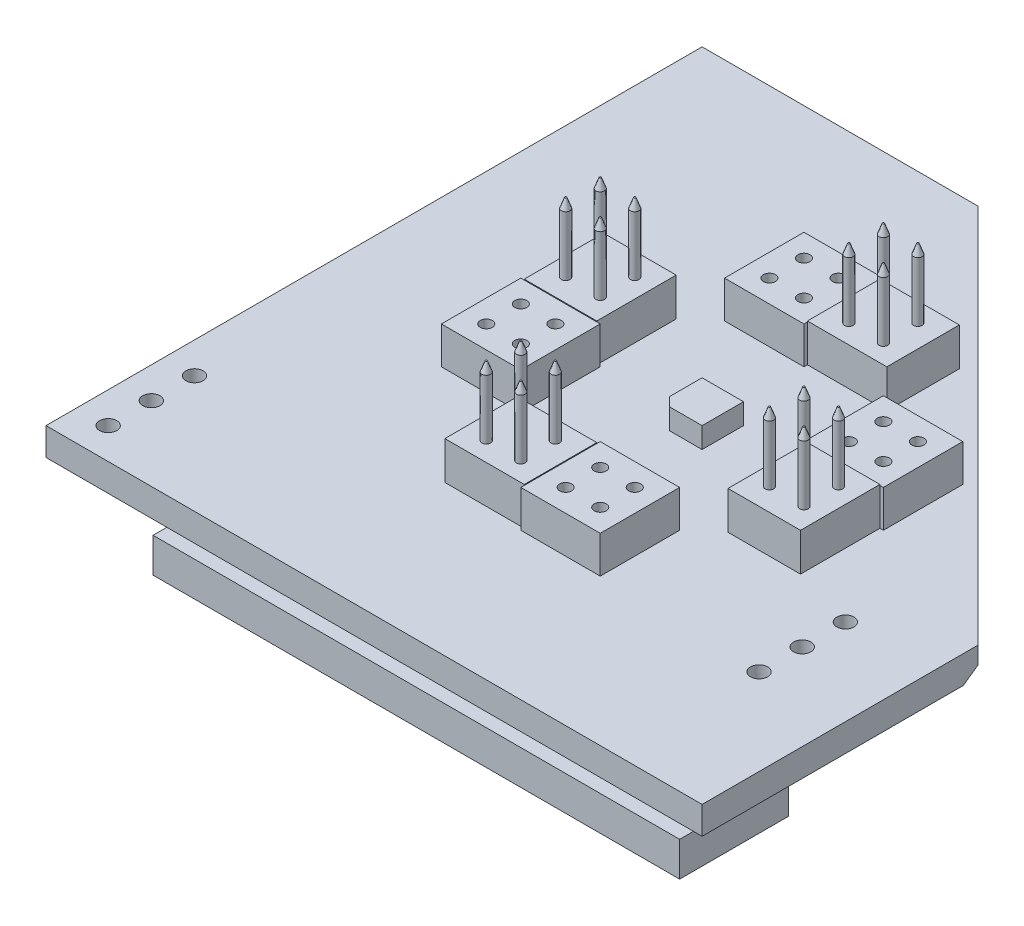
from build123d import *
from OCP.BRepFilletAPI import BRepFilletAPI_MakeChamfer
from build123d.topology import SkipClean

# Parameters (mm, degrees)
EXTRUDE1_DEPTH       = 1.6
SKETCH2_W            = 4.6
SKETCH2_H            = 4.6
EXTRUDE2_DEPTH       = 2.15
SKETCH3_W            = 4.6
SKETCH3_H            = 4.2
SKETCH3_W_2          = 4.2
SKETCH3_H_2          = 4.6
EXTRUDE3_DEPTH       = 2.2
SKETCH4_R            = 0.35
CUT_EXTRUDE1_DEPTH   = 2.15
SKETCH5_R            = 0.25
EXTRUDE4_DEPTH       = 4
CHAMFER1_SIZE        = 0.2
CHAMFER1_SIZE2       = 0.549495484
SKETCH6_W            = 30.5
SKETCH6_H            = 6.3
EXTRUDE5_DEPTH       = 2
CHAMFER2_SIZE        = 0.6
EXTRUDE7_DEPTH       = 1.2
SKETCH14_R           = 0.5
CUT_EXTRUDE2_DEPTH   = 29.528582159
EXTRUDE13_DEPTH      = 0.05
EXTRUDE13_DEPTH_BACK = 1.05
SKETCH15_R           = 0.95
SKETCH15_R_2         = 0.5
SKETCH21_W           = 3.25
SKETCH21_H           = 3.25
EXTRUDE19_DEPTH      = 1.1
SKETCH22_W           = 0.8
SKETCH22_H           = 1.6
SKETCH22_W_2         = 2
SKETCH22_H_2         = 1.3
SKETCH22_W_3         = 1.6
SKETCH22_H_3         = 0.8
EXTRUDE20_DEPTH      = 0.5
EXTRUDE21_DEPTH      = 5
SKETCH24_W           = 7.3
SKETCH24_H           = 4.25
EXTRUDE22_DEPTH      = 2.8
SKETCH25_W           = 4.7
SKETCH25_H           = 6
EXTRUDE23_DEPTH      = 1.5
SKETCH26_W           = 2.2
SKETCH26_H           = 4.2
EXTRUDE24_DEPTH      = 2.3


with BuildPart() as part:
    # Sketch1 → Extrude1 (new body)
    with BuildSketch(Plane(origin=(0, 0, 0), x_dir=(1, 0, 0), z_dir=(0, 1, 0))):
        Polygon((19, -3.019386745), (-3.019386745, 19), (-19, 19), (-19, -19), (19, -19), align=None)
    extrude(amount=EXTRUDE1_DEPTH)

    # Sketch2 → Extrude2 (add)
    with BuildSketch(Plane(origin=(0, 1.6, 0), x_dir=(-1, 0, 0), z_dir=(0, 1, 0))):
        with Locations((-8.2, -2.3)):
            Rectangle(SKETCH2_W, SKETCH2_H)
        with Locations((2.3, -8.2)):
            Rectangle(SKETCH2_W, SKETCH2_H)
        with Locations((-2.3, 8.2)):
            Rectangle(SKETCH2_W, SKETCH2_H)
        with Locations((8.2, 2.3)):
            Rectangle(SKETCH2_W, SKETCH2_H)
    extrude(amount=EXTRUDE2_DEPTH)

    # Sketch3 → Extrude3 (add)
    with BuildSketch(Plane(origin=(0, 1.6, 0), x_dir=(-1, 0, 0), z_dir=(0, 1, 0))):
        with Locations((-2.3, -8.2)):
            Rectangle(SKETCH3_W, SKETCH3_H)
        with Locations((-8.2, 2.3)):
            Rectangle(SKETCH3_W_2, SKETCH3_H_2)
        with Locations((2.3, 8.2)):
            Rectangle(SKETCH3_W, SKETCH3_H)
        with Locations((8.2, -2.3)):
            Rectangle(SKETCH3_W_2, SKETCH3_H_2)
    extrude(amount=EXTRUDE3_DEPTH)

    # Sketch4 → Cut-Extrude1 (cut)
    with BuildSketch(Plane(origin=(0, 3.75, 0), x_dir=(-1, 0, 0), z_dir=(0, 1, 0))):
        with Locations(Location((3.3, -9.2, 0), (0, 0, 90))):
            Circle(SKETCH4_R)
        with Locations(Location((1.3, -9.2, 0), (0, 0, 90))):
            Circle(SKETCH4_R)
        with Locations(Location((1.3, -7.2, 0), (0, 0, 90))):
            Circle(SKETCH4_R)
        with Locations(Location((3.3, -7.2, 0), (0, 0, 90))):
            Circle(SKETCH4_R)
        with Locations(Location((-9.2, -3.3, 0), (0, 0, 90))):
            Circle(SKETCH4_R)
        with Locations(Location((-9.2, -1.3, 0), (0, 0, 90))):
            Circle(SKETCH4_R)
        with Locations(Location((-7.2, -1.3, 0), (0, 0, 90))):
            Circle(SKETCH4_R)
        with Locations(Location((-7.2, -3.3, 0), (0, 0, 90))):
            Circle(SKETCH4_R)
        with Locations(Location((-3.3, 9.2, 0), (0, 0, 90))):
            Circle(SKETCH4_R)
        with Locations(Location((-1.3, 9.2, 0), (0, 0, 90))):
            Circle(SKETCH4_R)
        with Locations(Location((-1.3, 7.2, 0), (0, 0, 90))):
            Circle(SKETCH4_R)
        with Locations(Location((-3.3, 7.2, 0), (0, 0, 90))):
            Circle(SKETCH4_R)
        with Locations(Location((9.2, 3.3, 0), (0, 0, 90))):
            Circle(SKETCH4_R)
        with Locations(Location((9.2, 1.3, 0), (0, 0, 90))):
            Circle(SKETCH4_R)
        with Locations(Location((7.2, 1.3, 0), (0, 0, 90))):
            Circle(SKETCH4_R)
        with Locations(Location((7.2, 3.3, 0), (0, 0, 90))):
            Circle(SKETCH4_R)
    extrude(amount=-CUT_EXTRUDE1_DEPTH, mode=Mode.SUBTRACT)

    # Sketch5 → Extrude4 (add)
    with BuildSketch(Plane(origin=(0, 3.8, 0), x_dir=(-1, 0, 0), z_dir=(0, 1, 0))):
        with Locations(Location((-1.3, -9.2, 0), (0, 0, 270))):
            Circle(SKETCH5_R)
        with Locations(Location((-3.3, -9.2, 0), (0, 0, 270))):
            Circle(SKETCH5_R)
        with Locations(Location((-3.3, -7.2, 0), (0, 0, 270))):
            Circle(SKETCH5_R)
        with Locations(Location((-1.3, -7.2, 0), (0, 0, 270))):
            Circle(SKETCH5_R)
        with Locations(Location((-7.2, 1.3, 0), (0, 0, 270))):
            Circle(SKETCH5_R)
        with Locations(Location((-9.2, 1.3, 0), (0, 0, 90))):
            Circle(SKETCH5_R)
        with Locations(Location((-9.2, 3.3, 0), (0, 0, 270))):
            Circle(SKETCH5_R)
        with Locations(Location((-7.2, 3.3, 0), (0, 0, 90))):
            Circle(SKETCH5_R)
        with Locations(Location((1.3, 7.2, 0), (0, 0, 270))):
            Circle(SKETCH5_R)
        with Locations(Location((1.3, 9.2, 0), (0, 0, 90))):
            Circle(SKETCH5_R)
        with Locations(Location((3.3, 9.2, 0), (0, 0, 270))):
            Circle(SKETCH5_R)
        with Locations(Location((3.3, 7.2, 0), (0, 0, 90))):
            Circle(SKETCH5_R)
        with Locations(Location((7.2, -1.3, 0), (0, 0, 270))):
            Circle(SKETCH5_R)
        with Locations(Location((9.2, -1.3, 0), (0, 0, 90))):
            Circle(SKETCH5_R)
        with Locations(Location((9.2, -3.3, 0), (0, 0, 270))):
            Circle(SKETCH5_R)
        with Locations(Location((7.2, -3.3, 0), (0, 0, 90))):
            Circle(SKETCH5_R)
    extrude(amount=EXTRUDE4_DEPTH)

    # Chamfer1: one chamfer whose edges measure the first distance from different faces: ONE call of the kernel's chamfer builder (chamfer() names one face for all edges)
    chamfer1_edges_1 = [part.edges().sort_by_distance(p)[0] for p in [
        (1.3, 7.8, -8.95),
    ]]
    chamfer1_side_1 = [part.faces().sort_by_distance(p)[0] for p in [
        (1.3, 7.8, -9.2),
    ]]
    chamfer1_edges_2 = [part.edges().sort_by_distance(p)[0] for p in [
        (3.3, 7.8, -8.95),
    ]]
    chamfer1_side_2 = [part.faces().sort_by_distance(p)[0] for p in [
        (3.3, 7.8, -9.2),
    ]]
    chamfer1_edges_3 = [part.edges().sort_by_distance(p)[0] for p in [
        (3.3, 7.8, -6.95),
    ]]
    chamfer1_side_3 = [part.faces().sort_by_distance(p)[0] for p in [
        (3.3, 7.8, -7.2),
    ]]
    chamfer1_edges_4 = [part.edges().sort_by_distance(p)[0] for p in [
        (1.3, 7.8, -6.95),
    ]]
    chamfer1_side_4 = [part.faces().sort_by_distance(p)[0] for p in [
        (1.3, 7.8, -7.2),
    ]]
    chamfer1_edges_5 = [part.edges().sort_by_distance(p)[0] for p in [
        (9.2, 7.8, 1.05),
    ]]
    chamfer1_side_5 = [part.faces().sort_by_distance(p)[0] for p in [
        (9.2, 7.8, 1.3),
    ]]
    chamfer1_edges_6 = [part.edges().sort_by_distance(p)[0] for p in [
        (9.2, 7.8, 3.55),
    ]]
    chamfer1_side_6 = [part.faces().sort_by_distance(p)[0] for p in [
        (9.2, 7.8, 3.3),
    ]]
    chamfer1_edges_7 = [part.edges().sort_by_distance(p)[0] for p in [
        (7.2, 7.8, 3.05),
    ]]
    chamfer1_side_7 = [part.faces().sort_by_distance(p)[0] for p in [
        (7.2, 7.8, 3.3),
    ]]
    chamfer1_edges_8 = [part.edges().sort_by_distance(p)[0] for p in [
        (7.2, 7.8, 1.55),
    ]]
    chamfer1_side_8 = [part.faces().sort_by_distance(p)[0] for p in [
        (7.2, 7.8, 1.3),
    ]]
    chamfer1_edges_9 = [part.edges().sort_by_distance(p)[0] for p in [
        (-1.3, 7.8, 8.95),
    ]]
    chamfer1_side_9 = [part.faces().sort_by_distance(p)[0] for p in [
        (-1.3, 7.8, 9.2),
    ]]
    chamfer1_edges_10 = [part.edges().sort_by_distance(p)[0] for p in [
        (-3.3, 7.8, 9.45),
    ]]
    chamfer1_side_10 = [part.faces().sort_by_distance(p)[0] for p in [
        (-3.3, 7.8, 9.2),
    ]]
    chamfer1_edges_11 = [part.edges().sort_by_distance(p)[0] for p in [
        (-3.3, 7.8, 6.95),
    ]]
    chamfer1_side_11 = [part.faces().sort_by_distance(p)[0] for p in [
        (-3.3, 7.8, 7.2),
    ]]
    chamfer1_edges_12 = [part.edges().sort_by_distance(p)[0] for p in [
        (-1.3, 7.8, 7.45),
    ]]
    chamfer1_side_12 = [part.faces().sort_by_distance(p)[0] for p in [
        (-1.3, 7.8, 7.2),
    ]]
    chamfer1_edges_13 = [part.edges().sort_by_distance(p)[0] for p in [
        (-9.2, 7.8, -1.55),
    ]]
    chamfer1_side_13 = [part.faces().sort_by_distance(p)[0] for p in [
        (-9.2, 7.8, -1.3),
    ]]
    chamfer1_edges_14 = [part.edges().sort_by_distance(p)[0] for p in [
        (-9.2, 7.8, -3.05),
    ]]
    chamfer1_side_14 = [part.faces().sort_by_distance(p)[0] for p in [
        (-9.2, 7.8, -3.3),
    ]]
    chamfer1_edges_15 = [part.edges().sort_by_distance(p)[0] for p in [
        (-7.2, 7.8, -3.55),
    ]]
    chamfer1_side_15 = [part.faces().sort_by_distance(p)[0] for p in [
        (-7.2, 7.8, -3.3),
    ]]
    chamfer1_edges_16 = [part.edges().sort_by_distance(p)[0] for p in [
        (-7.2, 7.8, -1.05),
    ]]
    chamfer1_side_16 = [part.faces().sort_by_distance(p)[0] for p in [
        (-7.2, 7.8, -1.3),
    ]]
    chamfer1 = BRepFilletAPI_MakeChamfer(part.part.solid().wrapped)
    for e in chamfer1_edges_1:
        chamfer1.Add(CHAMFER1_SIZE, CHAMFER1_SIZE2, e.wrapped, chamfer1_side_1[0].wrapped)  # the first distance lies on this face
    for e in chamfer1_edges_2:
        chamfer1.Add(CHAMFER1_SIZE, CHAMFER1_SIZE2, e.wrapped, chamfer1_side_2[0].wrapped)  # the first distance lies on this face
    for e in chamfer1_edges_3:
        chamfer1.Add(CHAMFER1_SIZE, CHAMFER1_SIZE2, e.wrapped, chamfer1_side_3[0].wrapped)  # the first distance lies on this face
    for e in chamfer1_edges_4:
        chamfer1.Add(CHAMFER1_SIZE, CHAMFER1_SIZE2, e.wrapped, chamfer1_side_4[0].wrapped)  # the first distance lies on this face
    for e in chamfer1_edges_5:
        chamfer1.Add(CHAMFER1_SIZE, CHAMFER1_SIZE2, e.wrapped, chamfer1_side_5[0].wrapped)  # the first distance lies on this face
    for e in chamfer1_edges_6:
        chamfer1.Add(CHAMFER1_SIZE, CHAMFER1_SIZE2, e.wrapped, chamfer1_side_6[0].wrapped)  # the first distance lies on this face
    for e in chamfer1_edges_7:
        chamfer1.Add(CHAMFER1_SIZE, CHAMFER1_SIZE2, e.wrapped, chamfer1_side_7[0].wrapped)  # the first distance lies on this face
    for e in chamfer1_edges_8:
        chamfer1.Add(CHAMFER1_SIZE, CHAMFER1_SIZE2, e.wrapped, chamfer1_side_8[0].wrapped)  # the first distance lies on this face
    for e in chamfer1_edges_9:
        chamfer1.Add(CHAMFER1_SIZE, CHAMFER1_SIZE2, e.wrapped, chamfer1_side_9[0].wrapped)  # the first distance lies on this face
    for e in chamfer1_edges_10:
        chamfer1.Add(CHAMFER1_SIZE, CHAMFER1_SIZE2, e.wrapped, chamfer1_side_10[0].wrapped)  # the first distance lies on this face
    for e in chamfer1_edges_11:
        chamfer1.Add(CHAMFER1_SIZE, CHAMFER1_SIZE2, e.wrapped, chamfer1_side_11[0].wrapped)  # the first distance lies on this face
    for e in chamfer1_edges_12:
        chamfer1.Add(CHAMFER1_SIZE, CHAMFER1_SIZE2, e.wrapped, chamfer1_side_12[0].wrapped)  # the first distance lies on this face
    for e in chamfer1_edges_13:
        chamfer1.Add(CHAMFER1_SIZE, CHAMFER1_SIZE2, e.wrapped, chamfer1_side_13[0].wrapped)  # the first distance lies on this face
    for e in chamfer1_edges_14:
        chamfer1.Add(CHAMFER1_SIZE, CHAMFER1_SIZE2, e.wrapped, chamfer1_side_14[0].wrapped)  # the first distance lies on this face
    for e in chamfer1_edges_15:
        chamfer1.Add(CHAMFER1_SIZE, CHAMFER1_SIZE2, e.wrapped, chamfer1_side_15[0].wrapped)  # the first distance lies on this face
    for e in chamfer1_edges_16:
        chamfer1.Add(CHAMFER1_SIZE, CHAMFER1_SIZE2, e.wrapped, chamfer1_side_16[0].wrapped)  # the first distance lies on this face
    add(Compound.cast(chamfer1.Shape()), mode=Mode.REPLACE)

    # Sketch6 → Extrude5 (add)
    with BuildSketch(Plane.XZ):
        with Locations((3.25, 16.65)):
            Rectangle(SKETCH6_W, SKETCH6_H)
    extrude(amount=EXTRUDE5_DEPTH)

    # Chamfer2
    chamfer2_edges = [part.edges().sort_by_distance(p)[0] for p in [
        (7.990306627, 0, -7.990306627),
    ]]
    chamfer(chamfer2_edges, length=CHAMFER2_SIZE)

    # Sketch8 → Extrude7 (add)
    with BuildSketch(Plane(origin=(0, 1.6, 0), x_dir=(-1, 0, 0), z_dir=(0, 1, 0))):
        Polygon((1.2, 0.7), (0.7, 1.2), (-1.2, 1.2), (-1.2, -1.2), (1.2, -1.2), align=None)
    extrude(amount=EXTRUDE7_DEPTH)

    # Sketch14 → Cut-Extrude2 (cut, through all)
    with BuildSketch(Plane.XZ):
        with Locations(Location((-17.2, 17.2, 0), (0, 0, 270))):
            Circle(SKETCH14_R)
        with Locations(Location((-17.2, 14.7, 0), (0, 0, 270))):
            Circle(SKETCH14_R)
        with Locations(Location((-17.2, 12.2, 0), (0, 0, 270))):
            Circle(SKETCH14_R)
        with Locations(Location((14, 8.2, 0), (0, 0, 90))):
            Circle(SKETCH14_R)
        with Locations(Location((14, 5.7, 0), (0, 0, 90))):
            Circle(SKETCH14_R)
        with Locations(Location((14, 10.7, 0), (0, 0, 90))):
            Circle(SKETCH14_R)
    extrude(amount=-CUT_EXTRUDE2_DEPTH, mode=Mode.SUBTRACT)

    # Sketch15 → Extrude13 (add, two sides: drawn at the far end of the back side and taken through both)
    # profile 1 of 6: a face of its own
    with SkipClean():  # the faces are left unmerged after this step: merging them gives an invalid solid
        with BuildSketch(Plane.XZ.offset(-EXTRUDE13_DEPTH_BACK)):
            with Locations(Location((14, 10.7, 0), (0, 0, 90))):
                Circle(SKETCH15_R)
            with Locations(Location((14, 10.7, 0), (0, 0, 270))):
                Circle(SKETCH15_R_2, mode=Mode.SUBTRACT)
        # profile 2 of 6: a face of its own
        with BuildSketch(Plane.XZ.offset(-EXTRUDE13_DEPTH_BACK)):
            with Locations(Location((14, 8.2, 0), (0, 0, 90))):
                Circle(SKETCH15_R)
            with Locations(Location((14, 8.2, 0), (0, 0, 270))):
                Circle(SKETCH15_R_2, mode=Mode.SUBTRACT)
        # profile 3 of 6: a face of its own
        with BuildSketch(Plane.XZ.offset(-EXTRUDE13_DEPTH_BACK)):
            with Locations(Location((14, 5.7, 0), (0, 0, 90))):
                Circle(SKETCH15_R)
            with Locations(Location((14, 5.7, 0), (0, 0, 270))):
                Circle(SKETCH15_R_2, mode=Mode.SUBTRACT)
        # profile 4 of 6: a face of its own
        with BuildSketch(Plane.XZ.offset(-EXTRUDE13_DEPTH_BACK)):
            with Locations(Location((-17.2, 17.2, 0), (0, 0, 90))):
                Circle(SKETCH15_R)
            with Locations(Location((-17.2, 17.2, 0), (0, 0, 270))):
                Circle(SKETCH15_R_2, mode=Mode.SUBTRACT)
        # profile 5 of 6: a face of its own
        with BuildSketch(Plane.XZ.offset(-EXTRUDE13_DEPTH_BACK)):
            with Locations(Location((-17.2, 14.7, 0), (0, 0, 90))):
                Circle(SKETCH15_R)
            with Locations(Location((-17.2, 14.7, 0), (0, 0, 270))):
                Circle(SKETCH15_R_2, mode=Mode.SUBTRACT)
        # profile 6 of 6: a face of its own
        with BuildSketch(Plane.XZ.offset(-EXTRUDE13_DEPTH_BACK)):
            with Locations(Location((-17.2, 12.2, 0), (0, 0, 90))):
                Circle(SKETCH15_R)
            with Locations(Location((-17.2, 12.2, 0), (0, 0, 270))):
                Circle(SKETCH15_R_2, mode=Mode.SUBTRACT)
        extrude(amount=EXTRUDE13_DEPTH + EXTRUDE13_DEPTH_BACK)
    add(part.part.scale(1), mode=Mode.REPLACE)  # the faces are merged on a copy

    # Sketch21 → Extrude19 (add)
    with BuildSketch(Plane.XZ):
        with Locations((2.475, 3.825)):
            Rectangle(SKETCH21_W, SKETCH21_H)
    extrude(amount=EXTRUDE19_DEPTH)

    # Sketch22 → Extrude20 (add)
    with BuildSketch(Plane.XZ):
        with Locations((11.85, 10.1)):
            Rectangle(SKETCH22_W, SKETCH22_H)
        with Locations((11.85, 6.6)):
            Rectangle(SKETCH22_W, SKETCH22_H)
        with Locations((5.05, -1.45)):
            Rectangle(SKETCH22_W, SKETCH22_H)
        with Locations((3.55, -1.45)):
            Rectangle(SKETCH22_W, SKETCH22_H)
        with Locations((0.25, -0.95)):
            Rectangle(SKETCH22_W, SKETCH22_H)
        with Locations((7, 2.85)):
            Rectangle(SKETCH22_W_2, SKETCH22_H_2)
        with Locations((-5.55, 2.25)):
            Rectangle(SKETCH22_W, SKETCH22_H)
        with Locations((-14.25, -5.4)):
            Rectangle(SKETCH22_W, SKETCH22_H)
        with Locations((-15.1, -2.1)):
            Rectangle(SKETCH22_W_3, SKETCH22_H_3)
    extrude(amount=EXTRUDE20_DEPTH)

    # Sketch23 → Extrude21 (add)
    with BuildSketch(Plane.XZ):
        Polygon((-15.35, 11.65), (-7.35, 11.65), (-6.15, 10.45), (-6.15, 2.45), (-7.35, 1.25), (-15.35, 1.25), (-16.55, 2.45), (-16.55, 10.45), align=None)
    extrude(amount=EXTRUDE21_DEPTH)

    # Sketch24 → Extrude22 (add)
    with BuildSketch(Plane.XZ):
        with Locations((-13.45, -9.425)):
            Rectangle(SKETCH24_W, SKETCH24_H)
        with Locations((-2.2, -9.275)):
            Rectangle(SKETCH24_W, SKETCH24_H)
    extrude(amount=EXTRUDE22_DEPTH)

    # Sketch25 → Extrude23 (add)
    with BuildSketch(Plane.XZ):
        with Locations((-9.3, -2.75)):
            Rectangle(SKETCH25_W, SKETCH25_H)
    extrude(amount=EXTRUDE23_DEPTH)

    # Sketch26 → Extrude24 (add)
    with BuildSketch(Plane.XZ):
        with Locations((-3.45, -2.25)):
            Rectangle(SKETCH26_W, SKETCH26_H)
    extrude(amount=EXTRUDE24_DEPTH)


solid = part.part
